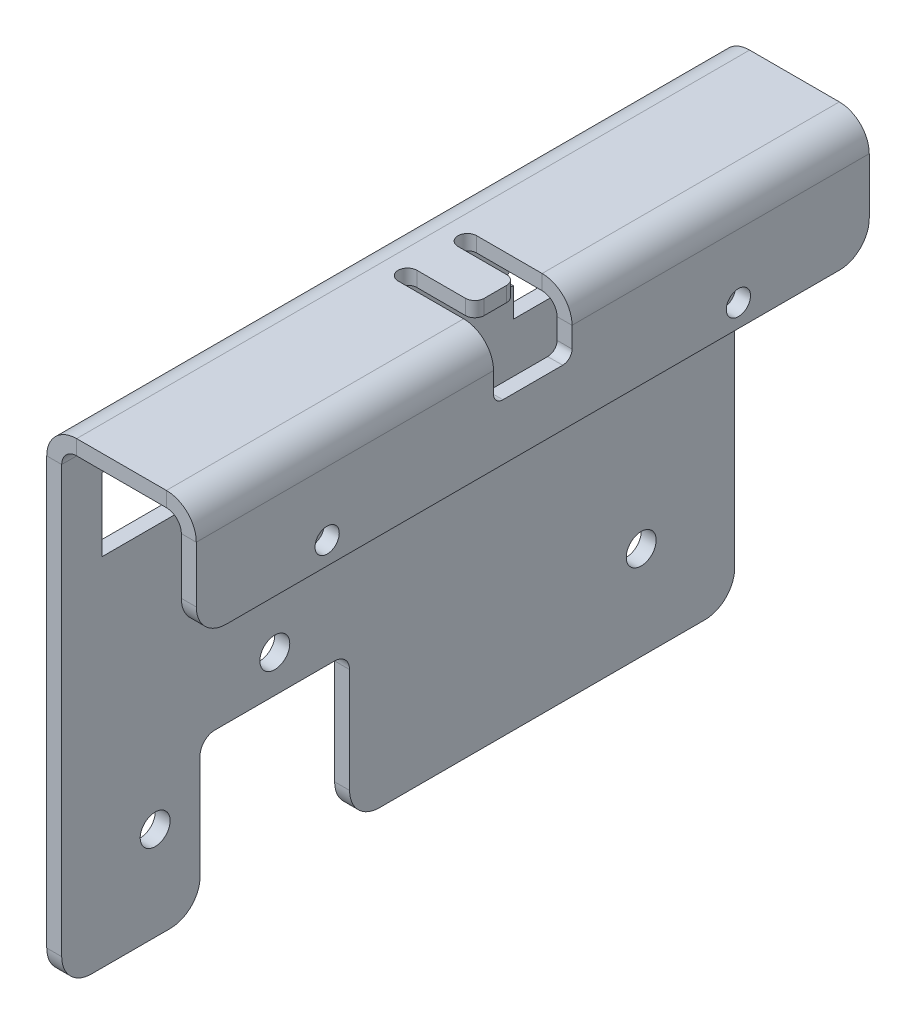
from build123d import *

# Parameters (mm, degrees)
BOSS_EXTRUDE1_DEPTH         = 2
F_4_0_4_DIAMETER_HOLE1_D    = 4
M3_CLEARANCE_HOLE1_D        = 3.242
CUT_EXTRUDE2_DEPTH          = 81.257405435
CUT_EXTRUDE3_DEPTH          = 81.257405435
SKETCHED_START              = 53.789908981
SKETCHED_BEND1_OUTLINE_W    = 2
SKETCHED_BEND1_OUTLINE_H    = 90
SKETCHED_BEND1_DEPTH        = 12.63486898
SKETCHED_START_2            = 52.212388981
SKETCHED_BEND1_2_OUTLINE_R  = 1.621
SKETCHED_BEND1_2_DEPTH      = 1.137013932
SKETCHED_START_3            = 50.212388981
SKETCHED_BEND1_3_OUTLINE_R  = 1.621
SKETCHED_BEND1_3_DEPTH      = 4
SKETCHED_START_4            = -45
SKETCHED_BEND1_4_DEPTH      = 90
SKETCHED_START_5            = -2
SKETCHED_BEND2_OUTLINE_W    = 16.712388981
SKETCHED_BEND2_OUTLINE_H    = 90
SKETCHED_BEND2_DEPTH        = 15.5
SKETCHED_BEND2_2_OUTLINE_W  = 2
SKETCHED_BEND2_2_OUTLINE_H  = 90
SKETCHED_BEND2_2_DEPTH      = 0.20548
SKETCHED_START_6            = 2
SKETCHED_BEND2_3_OUTLINE_W  = 2
SKETCHED_BEND2_3_OUTLINE_H  = 39.75
SKETCHED_BEND2_3_DEPTH      = 12
SKETCHED_START_7            = 1.58904
SKETCHED_BEND2_4_OUTLINE_W  = 2
SKETCHED_BEND2_4_OUTLINE_H  = 5.5
SKETCHED_BEND2_4_DEPTH      = 10.160960011
SKETCHED_BEND2_5_OUTLINE_W  = 2
SKETCHED_BEND2_5_OUTLINE_H  = 2.5
SKETCHED_BEND2_5_DEPTH      = 2.410960011
SKETCHED_START_8            = 14
SKETCHED_BEND2_6_OUTLINE_R  = 1.621
SKETCHED_BEND2_6_DEPTH      = 4
SKETCHED_BEND2_7_OUTLINE_R  = 1.621
SKETCHED_BEND2_7_DEPTH      = 2
SKETCHED_START_9            = 11.750000011
SKETCHED_BEND2_8_OUTLINE_W  = 2
SKETCHED_BEND2_8_OUTLINE_H  = 5.5
SKETCHED_BEND2_8_DEPTH      = 1.25
SKETCHED_START_10           = 4.000000011
SKETCHED_BEND2_9_OUTLINE_W  = 2
SKETCHED_BEND2_9_OUTLINE_H  = 2.5
SKETCHED_BEND2_9_DEPTH      = 1.25
SKETCHED_BEND2_10_DEPTH     = 90
SKETCHED_START_11           = 30
SKETCHED_BEND2_11_OUTLINE_W = 2
SKETCHED_BEND2_11_OUTLINE_H = 39.75
SKETCHED_BEND2_11_DEPTH     = 1.443495006
SKETCHED_START_12           = 37.29452
SKETCHED_BEND2_12_OUTLINE_W = 2
SKETCHED_BEND2_12_OUTLINE_H = 39.75
SKETCHED_BEND2_12_DEPTH     = 0.20548
SKETCHED_START_13           = 31.443495006
SKETCHED_BEND2_13_DEPTH     = 5.861984994


with BuildPart() as part:
    # Sketch7 → Boss-Extrude1 (new body)
    with BuildSketch(Plane(origin=(0, 0, 0), x_dir=(0, 0, -1), z_dir=(1, 0, 0))):
        with BuildLine():
            Line((-45, 62.424777961), (-45, -23.5))
            ThreePointArc((-45, -23.5), (-43.828427125, -26.328427125), (-41, -27.5))
            Line((-41, -27.5), (-30.5, -27.5))
            ThreePointArc((-30.5, -27.5), (-27.671572875, -26.328427125), (-26.5, -23.5))
            Line((-26.5, -23.5), (-26.5, -9.5))
            ThreePointArc((-26.5, -9.5), (-25.914213562, -8.085786438), (-24.5, -7.5))
            Line((-24.5, -7.5), (-8.5, -7.5))
            ThreePointArc((-8.5, -7.5), (-7.085786438, -8.085786438), (-6.5, -9.5))
            Line((-6.5, -9.5), (-6.5, -23.5))
            ThreePointArc((-6.5, -23.5), (-5.328427125, -26.328427125), (-2.5, -27.5))
            Line((-2.5, -27.5), (41, -27.5))
            ThreePointArc((41, -27.5), (43.828427125, -26.328427125), (45, -23.5))
            Line((45, -23.5), (45, 62.424777961))
            ThreePointArc((45, 62.424777961), (43.828427125, 65.253205086), (41, 66.424777961))
            Line((41, 66.424777961), (-41, 66.424777961))
            ThreePointArc((-41, 66.424777961), (-43.828427125, 65.253205086), (-45, 62.424777961))
        make_face()
    extrude(amount=-BOSS_EXTRUDE1_DEPTH)

    # Ø4.0 (4) Diameter Hole1 (through all)
    with Locations(Plane(origin=(0, 0, 0), x_dir=(0, 0, -1), z_dir=(1, 0, 0))):
        with Locations((-16.5, -2.5), (32.5, -15), (-16.5, 10), (-32.5, -15)):
            Hole(F_4_0_4_DIAMETER_HOLE1_D / 2)

    # M3 Clearance Hole1 (through all)
    with Locations(Plane(origin=(0, 0, 0), x_dir=(0, 0, -1), z_dir=(1, 0, 0))):
        with Locations((-27.5, 63.424777961), (27.5, 63.424777961)):
            Hole(M3_CLEARANCE_HOLE1_D / 2)

    # Sketch13 → Cut-Extrude2 (cut, through all)
    with BuildSketch(Plane.ZY.offset(2)):
        with BuildLine():
            Line((39.6, 29.874423052), (15.4, 29.874423052))
            Line((15.4, 29.874423052), (15.4, 26))
            ThreePointArc((15.4, 26), (14.4, 25), (15.4, 24))
            Line((15.4, 24), (15.4, 20.125576948))
            Line((15.4, 20.125576948), (39.6, 20.125576948))
            Line((39.6, 20.125576948), (39.6, 29.874423052))
        make_face()
        with BuildLine():
            Line((-15.4, 24), (-15.4, 20.125576948))
            Line((-15.4, 20.125576948), (-39.6, 20.125576948))
            Line((-39.6, 20.125576948), (-39.6, 29.874423052))
            Line((-39.6, 29.874423052), (-15.4, 29.874423052))
            Line((-15.4, 29.874423052), (-15.4, 26))
            ThreePointArc((-15.4, 26), (-14.4, 25), (-15.4, 24))
        make_face()
    extrude(amount=-CUT_EXTRUDE2_DEPTH, mode=Mode.SUBTRACT)

    # Sketch14 → Cut-Extrude3 (cut, through all)
    with BuildSketch(Plane.ZY.offset(2)):
        with BuildLine():
            Line((5.25, 41.462388992), (5.25, 57.674777954))
            ThreePointArc((5.25, 57.674777954), (4.883883476, 58.55866143), (4, 58.924777954))
            Line((4, 58.924777954), (-4, 58.924777954))
            ThreePointArc((-4, 58.924777954), (-4.883883476, 58.55866143), (-5.25, 57.674777954))
            Line((-5.25, 57.674777954), (-5.25, 41.462388992))
            ThreePointArc((-5.25, 41.462388992), (-4, 40.212388992), (-2.75, 41.462388992))
            Line((-2.75, 41.462388992), (-2.75, 47.962388992))
            ThreePointArc((-2.75, 47.962388992), (-2.383883476, 48.846272468), (-1.5, 49.212388992))
            Line((-1.5, 49.212388992), (1.5, 49.212388992))
            ThreePointArc((1.5, 49.212388992), (2.383883476, 48.846272468), (2.75, 47.962388992))
            Line((2.75, 47.962388992), (2.75, 41.462388992))
            ThreePointArc((2.75, 41.462388992), (4, 40.212388992), (5.25, 41.462388992))
        make_face()
    extrude(amount=-CUT_EXTRUDE3_DEPTH, mode=Mode.SUBTRACT)

    # Sketched Bend1: read off the stored shape, not the designer's step
    # Sketched Bend1 outline → Sketched Bend1 (cut)
    with BuildSketch(Plane(origin=(0, 0, 0), x_dir=(1, 0, 0), z_dir=(0, 1, 0)).offset(SKETCHED_START)):
        with Locations((-1, 0)):
            Rectangle(SKETCHED_BEND1_OUTLINE_W, SKETCHED_BEND1_OUTLINE_H)
    extrude(amount=SKETCHED_BEND1_DEPTH, mode=Mode.SUBTRACT)

    # Sketched Bend1 2 outline → Sketched Bend1 2 (add)
    with BuildSketch(Plane(origin=(0, 0, 0), x_dir=(1, 0, 0), z_dir=(0, 1, 0)).offset(SKETCHED_START_2)):
        with BuildLine():
            ThreePointArc((13.5, 41), (12.328427125, 43.828427125), (9.5, 45))
            Line((9.5, 45), (0, 45))
            Line((0, 45), (0, 5.25))
            Line((0, 5.25), (4.749999993, 5.25))
            ThreePointArc((4.749999993, 5.25), (5.633883469, 4.883883476), (5.999999993, 4))
            Line((5.999999993, 4), (5.999999993, -4))
            ThreePointArc((5.999999993, -4), (5.633883469, -4.883883476), (4.749999993, -5.25))
            Line((4.749999993, -5.25), (0, -5.25))
            Line((0, -5.25), (0, -45))
            Line((0, -45), (9.5, -45))
            ThreePointArc((9.5, -45), (12.328427125, -43.828427125), (13.5, -41))
            Line((13.5, -41), (13.5, 41))
        make_face()
        with Locations((10.5, -27.5)):
            Circle(SKETCHED_BEND1_2_OUTLINE_R, mode=Mode.SUBTRACT)
        with Locations((10.5, 27.5)):
            Circle(SKETCHED_BEND1_2_OUTLINE_R, mode=Mode.SUBTRACT)
    extrude(amount=SKETCHED_BEND1_2_DEPTH)

    # Sketched Bend1 3 outline → Sketched Bend1 3 (add)
    with BuildSketch(Plane(origin=(0, 0, 0), x_dir=(1, 0, 0), z_dir=(0, 1, 0)).offset(SKETCHED_START_3)):
        with BuildLine():
            ThreePointArc((13.5, 41), (12.328427125, 43.828427125), (9.5, 45))
            Line((9.5, 45), (0, 45))
            Line((0, 45), (0, 5.25))
            Line((0, 5.25), (4.749999993, 5.25))
            ThreePointArc((4.749999993, 5.25), (5.633883469, 4.883883476), (5.999999993, 4))
            Line((5.999999993, 4), (5.999999993, -4))
            ThreePointArc((5.999999993, -4), (5.633883469, -4.883883476), (4.749999993, -5.25))
            Line((4.749999993, -5.25), (0, -5.25))
            Line((0, -5.25), (0, -45))
            Line((0, -45), (9.5, -45))
            ThreePointArc((9.5, -45), (12.328427125, -43.828427125), (13.5, -41))
            Line((13.5, -41), (13.5, 41))
        make_face()
        with Locations((10.5, -27.5)):
            Circle(SKETCHED_BEND1_3_OUTLINE_R, mode=Mode.SUBTRACT)
        with Locations((10.5, 27.5)):
            Circle(SKETCHED_BEND1_3_OUTLINE_R, mode=Mode.SUBTRACT)
    extrude(amount=SKETCHED_BEND1_3_DEPTH)

    # Sketched Bend1 4 outline → Sketched Bend1 4 (cut)
    with BuildSketch(Plane.XY.offset(SKETCHED_START_4)):
        with BuildLine():
            ThreePointArc((-2, 50.212388981), (-0.828427125, 53.040816106), (2, 54.212388981))
            Line((2, 54.212388981), (0, 54.212388981))
            Line((0, 54.212388981), (0, 53.789908981))
            Line((0, 53.789908981), (-2, 53.789908981))
            Line((-2, 53.789908981), (-2, 50.212388981))
        make_face()
        with BuildLine():
            ThreePointArc((2, 52.212388981), (0.585786438, 51.626602543), (0, 50.212388981))
            Line((0, 50.212388981), (13.5, 50.212388981))
            Line((13.5, 50.212388981), (13.5, 52.212388981))
            Line((13.5, 52.212388981), (2, 52.212388981))
        make_face()
    extrude(amount=SKETCHED_BEND1_4_DEPTH, mode=Mode.SUBTRACT)

    # Sketched Bend2: read off the stored shape, not the designer's step
    # Sketched Bend2 outline → Sketched Bend2 (cut)
    with BuildSketch(Plane.YZ.offset(SKETCHED_START_5)):
        with Locations((45.856194491, 0)):
            Rectangle(SKETCHED_BEND2_OUTLINE_W, SKETCHED_BEND2_OUTLINE_H)
        with BuildLine():
            Line((52.212388981, 5.25), (52.212388981, -5.25))
            Line((52.212388981, -5.25), (41.462388992, -5.25))
            ThreePointArc((41.462388992, -5.25), (40.212388992, -4), (41.462388992, -2.75))
            Line((41.462388992, -2.75), (47.962388992, -2.75))
            ThreePointArc((47.962388992, -2.75), (48.846272468, -2.383883476), (49.212388992, -1.5))
            Line((49.212388992, -1.5), (49.212388992, 1.5))
            ThreePointArc((49.212388992, 1.5), (48.846272468, 2.383883476), (47.962388992, 2.75))
            Line((47.962388992, 2.75), (41.462388992, 2.75))
            ThreePointArc((41.462388992, 2.75), (40.212388992, 4), (41.462388992, 5.25))
            Line((41.462388992, 5.25), (52.212388981, 5.25))
        make_face(mode=Mode.SUBTRACT)
    extrude(amount=SKETCHED_BEND2_DEPTH, mode=Mode.SUBTRACT)

    # Sketched Bend2 2 outline → Sketched Bend2 2 (cut)
    with BuildSketch(Plane.YZ.offset(SKETCHED_START_5)):
        with Locations((36.5, 0)):
            Rectangle(SKETCHED_BEND2_2_OUTLINE_W, SKETCHED_BEND2_2_OUTLINE_H)
    extrude(amount=SKETCHED_BEND2_2_DEPTH, mode=Mode.SUBTRACT)



with BuildPart() as body_2:
    # Sketched Bend2 3 outline → Sketched Bend2 3 (new body)
    with BuildSketch(Plane.YZ.offset(SKETCHED_START_6)):
        with Locations((36.5, 25.125)):
            Rectangle(SKETCHED_BEND2_3_OUTLINE_W, SKETCHED_BEND2_3_OUTLINE_H)
        with Locations((36.5, -25.125)):
            Rectangle(SKETCHED_BEND2_3_OUTLINE_W, SKETCHED_BEND2_3_OUTLINE_H)
    extrude(amount=SKETCHED_BEND2_3_DEPTH)



with BuildPart() as body_3:
    # Sketched Bend2 4 outline → Sketched Bend2 4 (new body)
    with BuildSketch(Plane.YZ.offset(SKETCHED_START_7)):
        with Locations((36.5, 0)):
            Rectangle(SKETCHED_BEND2_4_OUTLINE_W, SKETCHED_BEND2_4_OUTLINE_H)
    extrude(amount=SKETCHED_BEND2_4_DEPTH)


with BuildPart() as body_2_1:
    add(body_2.part)

    add(body_3.part)  # Sketched Bend2 5 merges body 3
    # Sketched Bend2 5 outline → Sketched Bend2 5 (add)
    with BuildSketch(Plane.YZ.offset(SKETCHED_START_7)):
        with Locations((36.5, 4)):
            Rectangle(SKETCHED_BEND2_5_OUTLINE_W, SKETCHED_BEND2_5_OUTLINE_H)
        with Locations((36.5, -4)):
            Rectangle(SKETCHED_BEND2_5_OUTLINE_W, SKETCHED_BEND2_5_OUTLINE_H)
    extrude(amount=SKETCHED_BEND2_5_DEPTH)

    # Sketched Bend2 6 outline → Sketched Bend2 6 (add)
    with BuildSketch(Plane.YZ.offset(SKETCHED_START_8)):
        with BuildLine():
            Line((37.5, 45), (26, 45))
            ThreePointArc((26, 45), (23.171572875, 43.828427125), (22, 41))
            Line((22, 41), (22, -41))
            ThreePointArc((22, -41), (23.171572875, -43.828427125), (26, -45))
            Line((26, -45), (37.5, -45))
            Line((37.5, -45), (37.5, -5.25))
            Line((37.5, -5.25), (30.750000007, -5.25))
            ThreePointArc((30.750000007, -5.25), (29.866116531, -4.883883476), (29.500000007, -4))
            Line((29.500000007, -4), (29.500000007, 4))
            ThreePointArc((29.500000007, 4), (29.866116531, 4.883883476), (30.750000007, 5.25))
            Line((30.750000007, 5.25), (37.5, 5.25))
            Line((37.5, 5.25), (37.5, 45))
        make_face()
        with Locations((25, 27.5)):
            Circle(SKETCHED_BEND2_6_OUTLINE_R, mode=Mode.SUBTRACT)
        with Locations((25, -27.5)):
            Circle(SKETCHED_BEND2_6_OUTLINE_R, mode=Mode.SUBTRACT)
    extrude(amount=SKETCHED_BEND2_6_DEPTH)


with BuildPart() as part_1:
    add(part.part)

    add(body_2_1.part)  # Sketched Bend2 7 merges body 2
    # Sketched Bend2 7 outline → Sketched Bend2 7 (add)
    with BuildSketch(Plane.YZ):
        with BuildLine():
            Line((37.5, 45), (26, 45))
            ThreePointArc((26, 45), (23.171572875, 43.828427125), (22, 41))
            Line((22, 41), (22, -41))
            ThreePointArc((22, -41), (23.171572875, -43.828427125), (26, -45))
            Line((26, -45), (37.5, -45))
            Line((37.5, -45), (37.5, 45))
        make_face()
        with Locations((25, 27.5)):
            Circle(SKETCHED_BEND2_7_OUTLINE_R, mode=Mode.SUBTRACT)
        with Locations((25, -27.5)):
            Circle(SKETCHED_BEND2_7_OUTLINE_R, mode=Mode.SUBTRACT)
    extrude(amount=SKETCHED_BEND2_7_DEPTH)

    # Sketched Bend2 8 outline → Sketched Bend2 8 (add)
    with BuildSketch(Plane.YZ.offset(SKETCHED_START_9)):
        with Locations((36.5, 0)):
            Rectangle(SKETCHED_BEND2_8_OUTLINE_W, SKETCHED_BEND2_8_OUTLINE_H)
    extrude(amount=SKETCHED_BEND2_8_DEPTH)

    # Sketched Bend2 9 outline → Sketched Bend2 9 (add)
    with BuildSketch(Plane.YZ.offset(SKETCHED_START_10)):
        with Locations((36.5, 4)):
            Rectangle(SKETCHED_BEND2_9_OUTLINE_W, SKETCHED_BEND2_9_OUTLINE_H)
        with Locations((36.5, -4)):
            Rectangle(SKETCHED_BEND2_9_OUTLINE_W, SKETCHED_BEND2_9_OUTLINE_H)
    extrude(amount=SKETCHED_BEND2_9_DEPTH)

    # Sketched Bend2 10 outline → Sketched Bend2 10 (cut)
    with BuildSketch(Plane.XY.offset(SKETCHED_START_4)):
        with BuildLine():
            ThreePointArc((16, 33.5), (15.414213563, 34.914213563), (14, 35.5))
            Line((14, 35.5), (14, 22))
            Line((14, 22), (16, 22))
            Line((16, 22), (16, 33.5))
        make_face()
        with BuildLine():
            Line((2, 22), (2, 35.5))
            ThreePointArc((2, 35.5), (0.585786438, 34.914213562), (0, 33.5))
            Line((0, 33.5), (0, 22))
            Line((0, 22), (2, 22))
        make_face()
        with BuildLine():
            ThreePointArc((-2, 33.5), (-0.828427125, 36.328427125), (2, 37.5))
            Line((2, 37.5), (-1.79452, 37.5))
            Line((-1.79452, 37.5), (-1.79452, 35.5))
            Line((-1.79452, 35.5), (-2, 35.5))
            Line((-2, 35.5), (-2, 33.5))
        make_face()
        with BuildLine():
            ThreePointArc((14, 37.5), (16.828427125, 36.328427125), (18, 33.5))
            Line((18, 33.5), (18, 37.5))
            Line((18, 37.5), (14, 37.5))
        make_face()
    extrude(amount=SKETCHED_BEND2_10_DEPTH, mode=Mode.SUBTRACT)

    # Sketched Bend2 11 outline → Sketched Bend2 11 (cut)
    with BuildSketch(Plane(origin=(0, 0, 0), x_dir=(1, 0, 0), z_dir=(0, 1, 0)).offset(SKETCHED_START_11)):
        with Locations((15, -25.125)):
            Rectangle(SKETCHED_BEND2_11_OUTLINE_W, SKETCHED_BEND2_11_OUTLINE_H)
        with Locations((15, 25.125)):
            Rectangle(SKETCHED_BEND2_11_OUTLINE_W, SKETCHED_BEND2_11_OUTLINE_H)
    extrude(amount=SKETCHED_BEND2_11_DEPTH, mode=Mode.SUBTRACT)

    # Sketched Bend2 12 outline → Sketched Bend2 12 (cut)
    with BuildSketch(Plane(origin=(0, 0, 0), x_dir=(1, 0, 0), z_dir=(0, 1, 0)).offset(SKETCHED_START_12)):
        with BuildLine():
            Line((5.250000011, -5.25), (5.250000011, -2.75))
            ThreePointArc((5.250000011, -2.75), (4.000000011, -4), (5.250000011, -5.25))
        make_face()
        with BuildLine():
            ThreePointArc((13.000000011, -1.5), (12.633883488, -2.383883477), (11.750000011, -2.75))
            Line((11.750000011, -2.75), (13.000000011, -2.75))
            Line((13.000000011, -2.75), (13.000000011, -1.5))
        make_face()
        with Locations((17, -25.125)):
            Rectangle(SKETCHED_BEND2_12_OUTLINE_W, SKETCHED_BEND2_12_OUTLINE_H)
        with BuildLine():
            ThreePointArc((11.750000011, 2.75), (12.633883488, 2.383883477), (13.000000011, 1.5))
            Line((13.000000011, 1.5), (13.000000011, 2.75))
            Line((13.000000011, 2.75), (11.750000011, 2.75))
        make_face()
        with Locations((17, 25.125)):
            Rectangle(SKETCHED_BEND2_12_OUTLINE_W, SKETCHED_BEND2_12_OUTLINE_H)
        with BuildLine():
            Line((5.250000011, 2.75), (5.250000011, 5.25))
            ThreePointArc((5.250000011, 5.25), (4.000000011, 4), (5.250000011, 2.75))
        make_face()
    extrude(amount=SKETCHED_BEND2_12_DEPTH, mode=Mode.SUBTRACT)

    # Sketched Bend2 13 outline → Sketched Bend2 13 (cut)
    with BuildSketch(Plane(origin=(0, 0, 0), x_dir=(1, 0, 0), z_dir=(0, 1, 0)).offset(SKETCHED_START_13)):
        with BuildLine():
            Line((5.250000011, -5.25), (5.250000011, -2.75))
            ThreePointArc((5.250000011, -2.75), (4.000000011, -4), (5.250000011, -5.25))
        make_face()
        with BuildLine():
            ThreePointArc((13.000000011, -1.5), (12.633883488, -2.383883477), (11.750000011, -2.75))
            Line((11.750000011, -2.75), (13.000000011, -2.75))
            Line((13.000000011, -2.75), (13.000000011, -1.5))
        make_face()
        with BuildLine():
            ThreePointArc((11.750000011, 2.75), (12.633883488, 2.383883477), (13.000000011, 1.5))
            Line((13.000000011, 1.5), (13.000000011, 2.75))
            Line((13.000000011, 2.75), (11.750000011, 2.75))
        make_face()
        with BuildLine():
            Line((5.250000011, 2.75), (5.250000011, 5.25))
            ThreePointArc((5.250000011, 5.25), (4.000000011, 4), (5.250000011, 2.75))
        make_face()
    extrude(amount=SKETCHED_BEND2_13_DEPTH, mode=Mode.SUBTRACT)


solid = part_1.part
